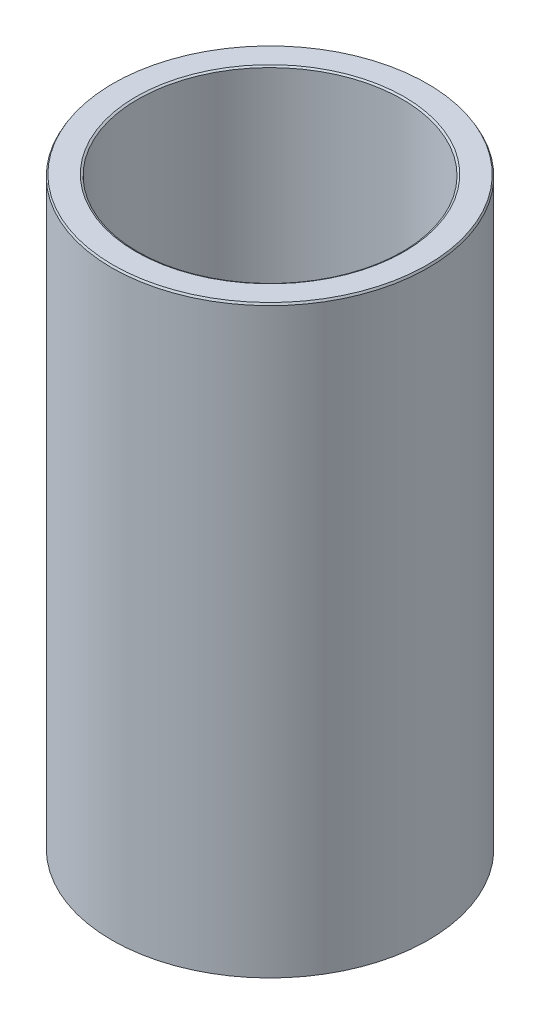
from build123d import *
from OCP.BRepFilletAPI import BRepFilletAPI_MakeChamfer

# Parameters (mm, degrees)
SKETCH1_R           = 50
BOSS_EXTRUDE1_DEPTH = 184.940125842
SKETCH2_R           = 41.776900537
CUT_EXTRUDE1_DEPTH  = 198.997096308
CHAMFER1_SIZE       = 0.616027188
CHAMFER1_SIZE2      = 0.355663463


with BuildPart() as part:
    # Sketch1 → Boss-Extrude1 (new body)
    with BuildSketch(Plane(origin=(0, 0, 0), x_dir=(1, 0, 0), z_dir=(0, 1, 0))):
        Circle(SKETCH1_R)
    extrude(amount=BOSS_EXTRUDE1_DEPTH)

    # Sketch2 → Cut-Extrude1 (cut, through all)
    with BuildSketch(Plane(origin=(0, 0, 0), x_dir=(1, 0, 0), z_dir=(0, 1, 0))):
        Circle(SKETCH2_R)
    extrude(amount=CUT_EXTRUDE1_DEPTH, mode=Mode.SUBTRACT)

    # Chamfer1: one chamfer whose edges measure the first distance from different faces: ONE call of the kernel's chamfer builder (chamfer() names one face for all edges)
    chamfer1_edges_1 = [part.edges().sort_by_distance(p)[0] for p in [
        (-41.776900537, 184.940125842, 0),
    ]]
    chamfer1_side_1 = [part.faces().sort_by_distance(p)[0] for p in [
        (-48.585786438, 184.940125842, 0),
    ]]
    chamfer1_edges_2 = [part.edges().sort_by_distance(p)[0] for p in [
        (-41.776900537, 0, 0),
    ]]
    chamfer1_side_2 = [part.faces().sort_by_distance(p)[0] for p in [
        (-41.776900537, 92.470062921, 0),
    ]]
    chamfer1_edges_3 = [part.edges().sort_by_distance(p)[0] for p in [
        (-50, 0, 0),
    ]]
    chamfer1_side_3 = [part.faces().sort_by_distance(p)[0] for p in [
        (-48.585786438, 0, 0),
    ]]
    chamfer1_edges_4 = [part.edges().sort_by_distance(p)[0] for p in [
        (-50, 184.940125842, 0),
    ]]
    chamfer1_side_4 = [part.faces().sort_by_distance(p)[0] for p in [
        (-50, 92.470062921, 0),
    ]]
    chamfer1 = BRepFilletAPI_MakeChamfer(part.part.solid().wrapped)
    for e in chamfer1_edges_1:
        chamfer1.Add(CHAMFER1_SIZE, CHAMFER1_SIZE2, e.wrapped, chamfer1_side_1[0].wrapped)  # the first distance lies on this face
    for e in chamfer1_edges_2:
        chamfer1.Add(CHAMFER1_SIZE, CHAMFER1_SIZE2, e.wrapped, chamfer1_side_2[0].wrapped)  # the first distance lies on this face
    for e in chamfer1_edges_3:
        chamfer1.Add(CHAMFER1_SIZE, CHAMFER1_SIZE2, e.wrapped, chamfer1_side_3[0].wrapped)  # the first distance lies on this face
    for e in chamfer1_edges_4:
        chamfer1.Add(CHAMFER1_SIZE, CHAMFER1_SIZE2, e.wrapped, chamfer1_side_4[0].wrapped)  # the first distance lies on this face
    add(Compound.cast(chamfer1.Shape()), mode=Mode.REPLACE)


solid = part.part
